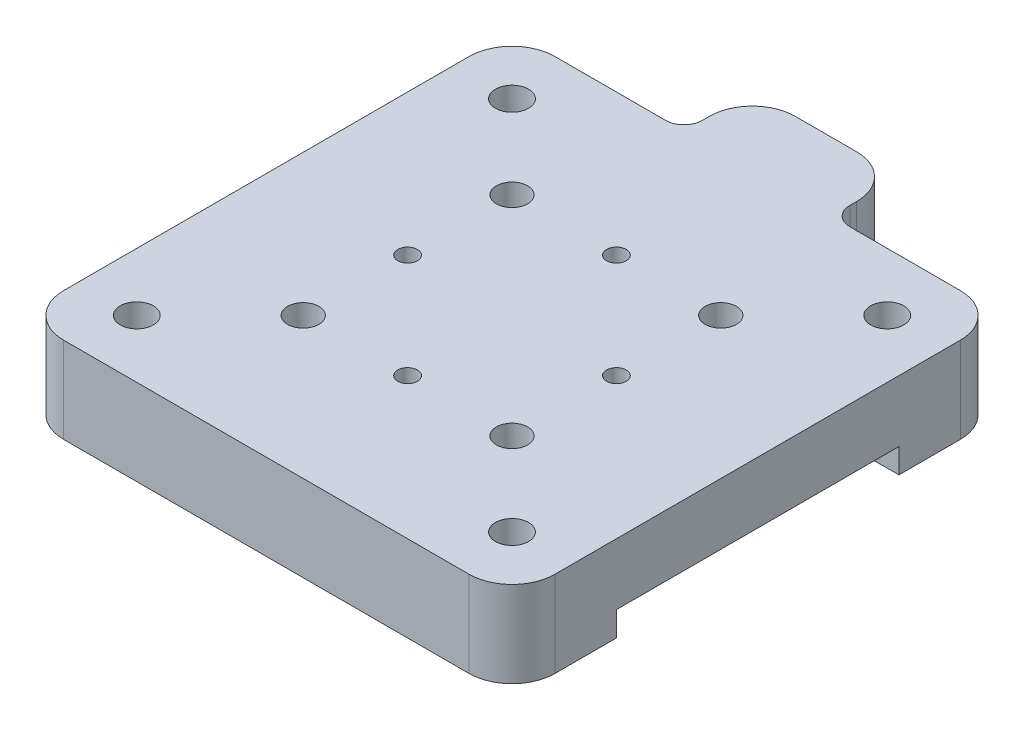
from build123d import *
from build123d.topology import SkipClean

# Parameters (mm, degrees)
SKETCH1_R                       = 2.7
BOSS_EXTRUDE1_DEPTH             = 10
SKETCH3_W                       = 17
SKETCH3_H                       = 4
BOSS_EXTRUDE2_DEPTH             = 80
CUT_EXTRUDE1_START              = -36
SKETCH4_R                       = 2.7
CUT_EXTRUDE1_DEPTH              = 36
BOSS_EXTRUDE3_START             = 3
SKETCH5_R                       = 4.7
SKETCH5_R_2                     = 2.7
BOSS_EXTRUDE3_DEPTH             = 3
CHAMFER1_SIZE                   = 1
FILLET2_R                       = 7
SKETCH6_R                       = 12.5
CUT_EXTRUDE2_DEPTH              = 2
CHAMFER2_SIZE                   = 2
SKETCH7_R                       = 3.25
CUT_EXTRUDE3_DEPTH              = 19
SKETCH8_R                       = 32.55
CUT_EXTRUDE4_DEPTH              = 2
BOSS_EXTRUDE4_REACH             = 60.523
SKETCH9_R                       = 32.55
BOSS_EXTRUDE4_DIRECTION_2_REACH = 60.523
SKETCH10_W                      = 12
SKETCH10_H                      = 17
BOSS_EXTRUDE5_DEPTH             = 3
SKETCH11_R                      = 4.5
BOSS_EXTRUDE6_DEPTH             = 7
SKETCH12_W                      = 24
SKETCH12_H                      = 11.128147065
BOSS_EXTRUDE7_DEPTH             = 17
CUT_EXTRUDE5_DEPTH              = 30
FILLET3_R                       = 7
FILLET4_R                       = 3


with BuildPart() as part:
    # Sketch1 → Boss-Extrude1 (new body)
    with BuildSketch(Plane(origin=(0, 0, 0), x_dir=(1, 0, 0), z_dir=(0, 1, 0))):
        Polygon((40, 40), (0, 40), (-30.55, 40), (-40, 40), (-40, -40), (40, -40), (40, 0), align=None)
        with Locations(Location((-30.55, -30.55, 0), (0, 0, 270))):
            Circle(SKETCH1_R, mode=Mode.SUBTRACT)
        with Locations(Location((30.55, -30.55, 0), (0, 0, 270))):
            Circle(SKETCH1_R, mode=Mode.SUBTRACT)
        with Locations(Location((-30.55, 30.55, 0), (0, 0, 270))):
            Circle(SKETCH1_R, mode=Mode.SUBTRACT)
        with Locations(Location((30.55, 30.55, 0), (0, 0, 270))):
            Circle(SKETCH1_R, mode=Mode.SUBTRACT)
    extrude(amount=BOSS_EXTRUDE1_DEPTH)

    # Sketch3 → Boss-Extrude2 (add)
    with BuildSketch(Plane.ZY.offset(40)):
        with Locations((-31.5, -2)):
            Rectangle(SKETCH3_W, SKETCH3_H)
        with Locations((31.5, -2)):
            Rectangle(SKETCH3_W, SKETCH3_H)
    extrude(amount=-BOSS_EXTRUDE2_DEPTH)

    # Sketch4 → Cut-Extrude1 (cut)
    with BuildSketch(Plane(origin=(0, 10, 0), x_dir=(1, 0, 0), z_dir=(0, 1, 0)).offset(CUT_EXTRUDE1_START)):
        with Locations(Location((30.55, -30.55, 0), (0, 0, 90))):
            Circle(SKETCH4_R)
        with Locations(Location((-30.55, -30.55, 0), (0, 0, 90))):
            Circle(SKETCH4_R)
        with Locations(Location((-30.55, 30.55, 0), (0, 0, 90))):
            Circle(SKETCH4_R)
        with Locations(Location((30.55, 30.55, 0), (0, 0, 90))):
            Circle(SKETCH4_R)
    extrude(amount=CUT_EXTRUDE1_DEPTH, mode=Mode.SUBTRACT)

    # Sketch5 → Boss-Extrude3 (add)
    # profile 1 of 4: a face of its own
    with SkipClean():  # the faces are left unmerged after this step: merging them gives an invalid solid
        with BuildSketch(Plane.XZ.offset(4).offset(BOSS_EXTRUDE3_START)):
            with Locations(Location((-30.55, -30.55, 0), (0, 0, 270))):
                Circle(SKETCH5_R)
            with Locations(Location((-30.55, -30.55, 0), (0, 0, 270))):
                Circle(SKETCH5_R_2, mode=Mode.SUBTRACT)
        # profile 2 of 4: a face of its own
        with BuildSketch(Plane.XZ.offset(4).offset(BOSS_EXTRUDE3_START)):
            with Locations(Location((-30.55, 30.55, 0), (0, 0, 270))):
                Circle(SKETCH5_R)
            with Locations(Location((-30.55, 30.55, 0), (0, 0, 270))):
                Circle(SKETCH5_R_2, mode=Mode.SUBTRACT)
        # profile 3 of 4: a face of its own
        with BuildSketch(Plane.XZ.offset(4).offset(BOSS_EXTRUDE3_START)):
            with Locations(Location((30.55, 30.55, 0), (0, 0, 270))):
                Circle(SKETCH5_R)
            with Locations(Location((30.55, 30.55, 0), (0, 0, 270))):
                Circle(SKETCH5_R_2, mode=Mode.SUBTRACT)
        # profile 4 of 4: a face of its own
        with BuildSketch(Plane.XZ.offset(4).offset(BOSS_EXTRUDE3_START)):
            with Locations(Location((30.55, -30.55, 0), (0, 0, 270))):
                Circle(SKETCH5_R)
            with Locations(Location((30.55, -30.55, 0), (0, 0, 270))):
                Circle(SKETCH5_R_2, mode=Mode.SUBTRACT)
        extrude(amount=-BOSS_EXTRUDE3_DEPTH)

    # Chamfer1
    chamfer1_edges = [part.edges().sort_by_distance(p)[0] for p in [
        (-30.55, -7, -25.85),
        (-30.55, -7, 35.25),
        (30.55, -7, 35.25),
        (30.55, -7, -25.85),
    ]]
    chamfer(chamfer1_edges, length=CHAMFER1_SIZE)

    # Fillet2
    fillet2_edges = [part.edges().sort_by_distance(p)[0] for p in [
        (40, 3, -40),
        (40, 3, 40),
        (-40, 3, 40),
        (-40, 3, -40),
    ]]
    fillet(fillet2_edges, radius=FILLET2_R)

    # Sketch6 → Cut-Extrude2 (cut)
    with SkipClean():  # the faces are left unmerged after this step: merging them gives an invalid solid
        with BuildSketch(Plane.XZ):
            with Locations(Location((0, 0, 0), (0, 0, 270))):
                Circle(SKETCH6_R)
        extrude(amount=-CUT_EXTRUDE2_DEPTH, mode=Mode.SUBTRACT)

    # Chamfer2
    chamfer2_edges = [part.edges().sort_by_distance(p)[0] for p in [
        (0, 0, 12.5),
    ]]
    chamfer(chamfer2_edges, length=CHAMFER2_SIZE - 0.0001)  # a hair under: the kernel refuses the full size

    # Sketch7 → Cut-Extrude3 (cut)
    with BuildSketch(Plane.XZ.offset(-2)):
        with Locations(Location((0, 0, 0), (0, 0, 270))):
            Circle(SKETCH7_R)
    extrude(amount=-CUT_EXTRUDE3_DEPTH, mode=Mode.SUBTRACT)

    # Sketch8 → Cut-Extrude4 (cut)
    with BuildSketch(Plane(origin=(0, 10, 0), x_dir=(1, 0, 0), z_dir=(0, 1, 0))):
        with Locations(Location((0, 0, 0), (0, 0, 270))):
            Circle(SKETCH8_R)
    extrude(amount=-CUT_EXTRUDE4_DEPTH, mode=Mode.SUBTRACT)

    # Boss-Extrude4: up to this face of the body (flat: up to its plane)
    boss_extrude4_end = Plane(part.part.faces().sort_by_distance((0, 10, -38.86862915))[0])
    # Sketch9 → Boss-Extrude4 (add, up to the picked face)
    with BuildSketch(Plane(origin=(0, 8, 0), x_dir=(1, 0, 0), z_dir=(0, 1, 0)), mode=Mode.PRIVATE) as boss_extrude4_sk1:
        Circle(SKETCH9_R)
    boss_extrude4_tool1 = split(extrude(boss_extrude4_sk1.sketch, amount=BOSS_EXTRUDE4_REACH, mode=Mode.PRIVATE), bisect_by=boss_extrude4_end, keep=Keep.BOTH, mode=Mode.PRIVATE)
    add(boss_extrude4_tool1.solids().sort_by(Axis((0, 8, 0), (0, 1, 0)))[0])

    # Boss-Extrude4 direction 2: up to this face of the body (flat: up to its plane)
    boss_extrude4_direction_2_end = Plane(part.part.faces().sort_by_distance((0, 0, 15.42272176))[0])
    # Sketch9 → Boss-Extrude4 direction 2 (add, up to the picked face)
    with BuildSketch(Plane(origin=(0, 8, 0), x_dir=(1, 0, 0), z_dir=(0, 1, 0)), mode=Mode.PRIVATE) as boss_extrude4_direction_2_sk1:
        Circle(SKETCH9_R)
    boss_extrude4_direction_2_tool1 = split(extrude(boss_extrude4_direction_2_sk1.sketch, amount=-BOSS_EXTRUDE4_DIRECTION_2_REACH, mode=Mode.PRIVATE), bisect_by=boss_extrude4_direction_2_end, keep=Keep.BOTH, mode=Mode.PRIVATE)
    add(boss_extrude4_direction_2_tool1.solids().sort_by(Axis((0, 8, 0), (0, -1, 0)))[0])

    # Sketch10 → Boss-Extrude5 (add)
    with BuildSketch(Plane.XZ.offset(4)):
        with Locations((6, -31.5)):
            Rectangle(SKETCH10_W, SKETCH10_H)
        with Locations((-6, -31.5)):
            Rectangle(SKETCH10_W, SKETCH10_H)
    extrude(amount=BOSS_EXTRUDE5_DEPTH)

    # Sketch11 → Boss-Extrude6 (add)
    with BuildSketch(Plane.XZ.offset(7)):
        with Locations(Location((0, -40, 0), (0, 0, 180))):
            Circle(SKETCH11_R)
        with BuildLine():
            Line((9.874300694, -23), (1.2, -23))
            Line((1.2, -23), (1.2, -32.236624446))
            ThreePointArc((1.2, -32.236624446), (1.585886298, -33.570986936), (2.624418605, -34.493419665))
            ThreePointArc((2.624418605, -34.493419665), (6.1, -40), (2.624418605, -45.506580335))
            ThreePointArc((2.624418605, -45.506580335), (1.585886298, -46.429013064), (1.2, -47.763375554))
            Line((1.2, -47.763375554), (1.2, -51.128147065))
            Line((1.2, -51.128147065), (9.874300694, -51.128147065))
            Line((9.874300694, -51.128147065), (12, -51.128147065))
            Line((12, -51.128147065), (12, -23))
            Line((12, -23), (9.874300694, -23))
        make_face()
        with BuildLine():
            Line((-1.2, -32.236624446), (-1.2, -23))
            Line((-1.2, -23), (-9.908726598, -23))
            Line((-9.908726598, -23), (-12, -23))
            Line((-12, -23), (-12, -51.128147065))
            Line((-12, -51.128147065), (-9.908726598, -51.128147065))
            Line((-9.908726598, -51.128147065), (-1.2, -51.128147065))
            Line((-1.2, -51.128147065), (-1.2, -47.763375554))
            ThreePointArc((-1.2, -47.763375554), (-1.585886298, -46.429013064), (-2.624418605, -45.506580335))
            ThreePointArc((-2.624418605, -45.506580335), (-6.1, -40), (-2.624418605, -34.493419665))
            ThreePointArc((-2.624418605, -34.493419665), (-1.585886298, -33.570986936), (-1.2, -32.236624446))
        make_face()
    extrude(amount=BOSS_EXTRUDE6_DEPTH)

    # Sketch12 → Boss-Extrude7 (add)
    with BuildSketch(Plane(origin=(0, -7, 0), x_dir=(1, 0, 0), z_dir=(0, 1, 0))):
        with Locations((0, 45.564073533)):
            Rectangle(SKETCH12_W, SKETCH12_H)
    extrude(amount=BOSS_EXTRUDE7_DEPTH)

    # Sketch13 → Cut-Extrude5 (cut)
    with BuildSketch(Plane(origin=(0, 10, 0), x_dir=(1, 0, 0), z_dir=(0, 1, 0))):
        with BuildLine():
            Line((-14.45, 17), (-17, 17))
            Line((-17, 17), (-17, 14.45))
            ThreePointArc((-17, 14.45), (-15.196877708, 15.196877708), (-14.45, 17))
        make_face()
        with BuildLine():
            Line((-17, 14.45), (-17, 17))
            Line((-17, 17), (-14.45, 17))
            ThreePointArc((-14.45, 17), (-18.803122292, 18.803122292), (-17, 14.45))
        make_face()
        with BuildLine():
            ThreePointArc((1.6, 17), (0, 18.6), (-1.6, 17))
            Line((-1.6, 17), (1.6, 17))
        make_face()
        with BuildLine():
            Line((1.6, 17), (-1.6, 17))
            ThreePointArc((-1.6, 17), (0, 15.4), (1.6, 17))
        make_face()
        with BuildLine():
            ThreePointArc((19.55, 17), (17, 19.55), (14.45, 17))
            Line((14.45, 17), (17, 17))
            Line((17, 17), (17, 14.45))
            ThreePointArc((17, 14.45), (18.803122292, 15.196877708), (19.55, 17))
        make_face()
        with BuildLine():
            Line((17, 17), (14.45, 17))
            ThreePointArc((14.45, 17), (15.196877708, 15.196877708), (17, 14.45))
            Line((17, 14.45), (17, 17))
        make_face()
        with BuildLine():
            ThreePointArc((18.6, 0), (18.13137085, 1.13137085), (17, 1.6))
            Line((17, 1.6), (17, -1.6))
            ThreePointArc((17, -1.6), (18.13137085, -1.13137085), (18.6, 0))
        make_face()
        with BuildLine():
            Line((17, -1.6), (17, 1.6))
            ThreePointArc((17, 1.6), (15.4, 0), (17, -1.6))
        make_face()
        with BuildLine():
            ThreePointArc((17, -14.45), (15.196877708, -15.196877708), (14.45, -17))
            Line((14.45, -17), (17, -17))
            Line((17, -17), (17, -14.45))
        make_face()
        with BuildLine():
            Line((17, -17), (14.45, -17))
            ThreePointArc((14.45, -17), (17, -19.55), (19.55, -17))
            ThreePointArc((19.55, -17), (18.803122292, -15.196877708), (17, -14.45))
            Line((17, -14.45), (17, -17))
        make_face()
        with BuildLine():
            ThreePointArc((1.6, -17), (0, -15.4), (-1.6, -17))
            Line((-1.6, -17), (1.6, -17))
        make_face()
        with BuildLine():
            Line((1.6, -17), (-1.6, -17))
            ThreePointArc((-1.6, -17), (0, -18.6), (1.6, -17))
        make_face()
        with BuildLine():
            ThreePointArc((-14.45, -17), (-15.196877708, -15.196877708), (-17, -14.45))
            Line((-17, -14.45), (-17, -17))
            Line((-17, -17), (-14.45, -17))
        make_face()
        with BuildLine():
            Line((-17, -17), (-17, -14.45))
            ThreePointArc((-17, -14.45), (-18.803122292, -18.803122292), (-14.45, -17))
            Line((-14.45, -17), (-17, -17))
        make_face()
        with BuildLine():
            ThreePointArc((-15.4, 0), (-15.86862915, 1.13137085), (-17, 1.6))
            Line((-17, 1.6), (-17, -1.6))
            ThreePointArc((-17, -1.6), (-15.86862915, -1.13137085), (-15.4, 0))
        make_face()
        with BuildLine():
            Line((-17, -1.6), (-17, 1.6))
            ThreePointArc((-17, 1.6), (-18.6, 0), (-17, -1.6))
        make_face()
    extrude(amount=-CUT_EXTRUDE5_DEPTH, mode=Mode.SUBTRACT)

    # Fillet3
    fillet3_edges = [part.edges().sort_by_distance(p)[0] for p in [
        (12, -2, -51.128147065),
        (-12, -2, -51.128147065),
    ]]
    fillet(fillet3_edges, radius=FILLET3_R)

    # Fillet4
    fillet4_edges = [part.edges().sort_by_distance(p)[0] for p in [
        (12, -4, -31.5),
        (-12, -4, -31.5),
        (-12, 3, -40),
        (12, 3, -40),
    ]]
    fillet(fillet4_edges, radius=FILLET4_R)


solid = part.part
